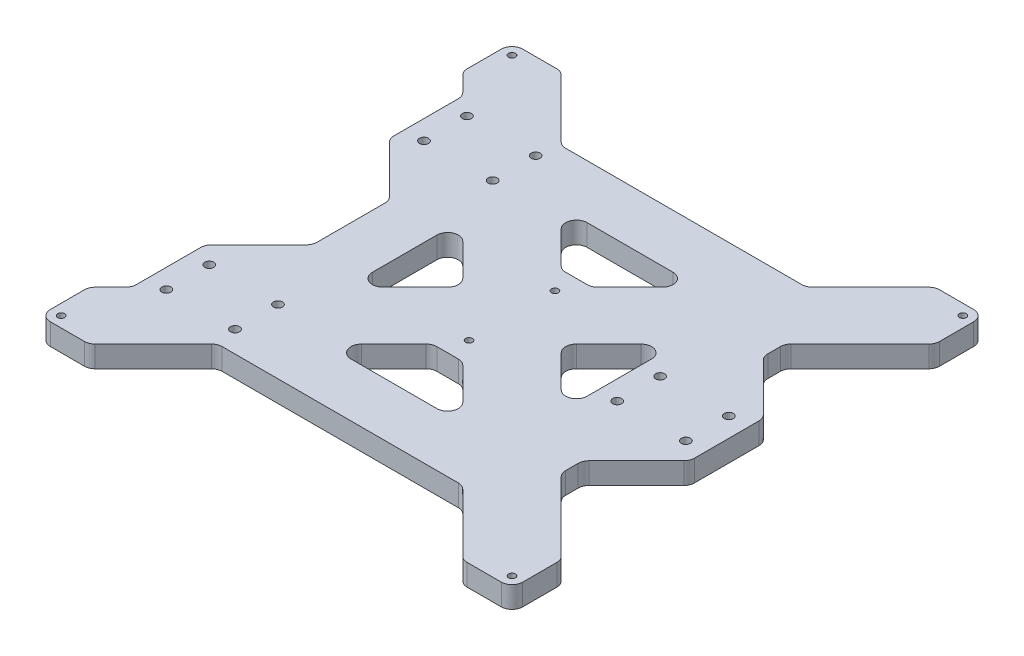
from build123d import *

# Parameters (mm, degrees)
SKETCH_1_R      = 1.6
SKETCH_1_R_2    = 2.1
EXTRUDE_1_DEPTH = 10


with BuildPart() as part:
    # Эскиз1 → Бобышка-Вытянуть1 (new body)
    with BuildSketch(Plane(origin=(0, 0, 0), x_dir=(1, 0, 0), z_dir=(0, 1, 0))):
        with BuildLine():
            Line((-89.142135624, 110), (-105, 110))
            ThreePointArc((-105, 110), (-108.535533906, 108.535533906), (-110, 105))
            Line((-110, 105), (-110, 89.142135624))
            ThreePointArc((-110, 89.142135624), (-109.619397663, 87.228718462), (-108.535533906, 85.606601718))
            Line((-108.535533906, 85.606601718), (-101.464466094, 78.535533906))
            ThreePointArc((-101.464466094, 78.535533906), (-100.380602337, 76.913417162), (-100, 75))
            Line((-100, 75), (-100, 45))
            ThreePointArc((-100, 45), (-99.619397663, 43.086582838), (-98.535533906, 41.464466094))
            Line((-98.535533906, 41.464466094), (-76.464466094, 19.393398282))
            ThreePointArc((-76.464466094, 19.393398282), (-75.380602337, 17.771281538), (-75, 15.857864376))
            Line((-75, 15.857864376), (-75, -15.857864376))
            ThreePointArc((-75, -15.857864376), (-75.380602337, -17.771281538), (-76.464466094, -19.393398282))
            Line((-76.464466094, -19.393398282), (-98.535533906, -41.464466094))
            ThreePointArc((-98.535533906, -41.464466094), (-99.619397663, -43.086582838), (-100, -45))
            Line((-100, -45), (-100, -75))
            ThreePointArc((-100, -75), (-100.380602337, -76.913417162), (-101.464466094, -78.535533906))
            Line((-101.464466094, -78.535533906), (-108.535533906, -85.606601718))
            ThreePointArc((-108.535533906, -85.606601718), (-109.619397663, -87.228718462), (-110, -89.142135624))
            Line((-110, -89.142135624), (-110, -105))
            ThreePointArc((-110, -105), (-108.535533906, -108.535533906), (-105, -110))
            Line((-105, -110), (-89.142135624, -110))
            ThreePointArc((-89.142135624, -110), (-87.228718462, -109.619397663), (-85.606601718, -108.535533906))
            Line((-85.606601718, -108.535533906), (-58.535533906, -81.464466094))
            ThreePointArc((-58.535533906, -81.464466094), (-56.913417162, -80.380602337), (-55, -80))
            Line((-55, -80), (55, -80))
            ThreePointArc((55, -80), (56.913417162, -80.380602337), (58.535533906, -81.464466094))
            Line((58.535533906, -81.464466094), (85.606601718, -108.535533906))
            ThreePointArc((85.606601718, -108.535533906), (87.228718462, -109.619397663), (89.142135624, -110))
            Line((89.142135624, -110), (105, -110))
            ThreePointArc((105, -110), (108.535533906, -108.535533906), (110, -105))
            Line((110, -105), (110, -89.142135624))
            ThreePointArc((110, -89.142135624), (109.619397663, -87.228718462), (108.535533906, -85.606601718))
            Line((108.535533906, -85.606601718), (76.464466094, -53.535533906))
            ThreePointArc((76.464466094, -53.535533906), (75.380602337, -51.913417162), (75, -50))
            Line((75, -50), (75, -44.142135624))
            ThreePointArc((75, -44.142135624), (75.380602337, -42.228718462), (76.464466094, -40.606601718))
            Line((76.464466094, -40.606601718), (98.535533906, -18.535533906))
            ThreePointArc((98.535533906, -18.535533906), (99.619397663, -16.913417162), (100, -15))
            Line((100, -15), (100, 15))
            ThreePointArc((100, 15), (99.619397663, 16.913417162), (98.535533906, 18.535533906))
            Line((98.535533906, 18.535533906), (76.464466094, 40.606601718))
            ThreePointArc((76.464466094, 40.606601718), (75.380602337, 42.228718462), (75, 44.142135624))
            Line((75, 44.142135624), (75, 50))
            ThreePointArc((75, 50), (75.380602337, 51.913417162), (76.464466094, 53.535533906))
            Line((76.464466094, 53.535533906), (108.535533906, 85.606601718))
            ThreePointArc((108.535533906, 85.606601718), (109.619397663, 87.228718462), (110, 89.142135624))
            Line((110, 89.142135624), (110, 105))
            ThreePointArc((110, 105), (108.535533906, 108.535533906), (105, 110))
            Line((105, 110), (89.142135624, 110))
            ThreePointArc((89.142135624, 110), (87.228718462, 109.619397663), (85.606601718, 108.535533906))
            Line((85.606601718, 108.535533906), (58.535533906, 81.464466094))
            ThreePointArc((58.535533906, 81.464466094), (56.913417162, 80.380602337), (55, 80))
            Line((55, 80), (-55, 80))
            ThreePointArc((-55, 80), (-56.913417162, 80.380602337), (-58.535533906, 81.464466094))
            Line((-58.535533906, 81.464466094), (-85.606601718, 108.535533906))
            ThreePointArc((-85.606601718, 108.535533906), (-87.228718462, 109.619397663), (-89.142135624, 110))
        make_face()
        with Locations((-105, -105)):
            Circle(SKETCH_1_R, mode=Mode.SUBTRACT)
        with Locations((-91, -70)):
            Circle(SKETCH_1_R_2, mode=Mode.SUBTRACT)
        with Locations((-59, -70)):
            Circle(SKETCH_1_R_2, mode=Mode.SUBTRACT)
        with Locations((-91, -50)):
            Circle(SKETCH_1_R_2, mode=Mode.SUBTRACT)
        with Locations((-59, -50)):
            Circle(SKETCH_1_R_2, mode=Mode.SUBTRACT)
        with Locations((105, -105)):
            Circle(SKETCH_1_R, mode=Mode.SUBTRACT)
        with BuildLine():
            ThreePointArc((-20, -55), (-24.619397663, -51.913417162), (-23.535533906, -46.464466094))
            Line((-23.535533906, -46.464466094), (-8.535533906, -31.464466094))
            ThreePointArc((-8.535533906, -31.464466094), (-6.913417162, -30.380602337), (-5, -30))
            Line((-5, -30), (5, -30))
            ThreePointArc((5, -30), (6.913417162, -30.380602337), (8.535533906, -31.464466094))
            Line((8.535533906, -31.464466094), (23.535533906, -46.464466094))
            ThreePointArc((23.535533906, -46.464466094), (24.619397663, -51.913417162), (20, -55))
            Line((20, -55), (-20, -55))
        make_face(mode=Mode.SUBTRACT)
        with Locations((0, -20)):
            Circle(SKETCH_1_R, mode=Mode.SUBTRACT)
        with Locations((59, -10)):
            Circle(SKETCH_1_R_2, mode=Mode.SUBTRACT)
        with Locations((91, -10)):
            Circle(SKETCH_1_R_2, mode=Mode.SUBTRACT)
        with Locations((-91, 50)):
            Circle(SKETCH_1_R_2, mode=Mode.SUBTRACT)
        with Locations((-59, 50)):
            Circle(SKETCH_1_R_2, mode=Mode.SUBTRACT)
        with BuildLine():
            Line((-50, -15), (-50, 15))
            ThreePointArc((-50, 15), (-46.913417162, 19.619397663), (-41.464466094, 18.535533906))
            Line((-41.464466094, 18.535533906), (-26.464466094, 3.535533906))
            ThreePointArc((-26.464466094, 3.535533906), (-25, 0), (-26.464466094, -3.535533906))
            Line((-26.464466094, -3.535533906), (-41.464466094, -18.535533906))
            ThreePointArc((-41.464466094, -18.535533906), (-46.913417162, -19.619397663), (-50, -15))
        make_face(mode=Mode.SUBTRACT)
        with Locations((-91, 70)):
            Circle(SKETCH_1_R_2, mode=Mode.SUBTRACT)
        with Locations((-59, 70)):
            Circle(SKETCH_1_R_2, mode=Mode.SUBTRACT)
        with Locations((-105, 105)):
            Circle(SKETCH_1_R, mode=Mode.SUBTRACT)
        with Locations((0, 20)):
            Circle(SKETCH_1_R, mode=Mode.SUBTRACT)
        with BuildLine():
            Line((26.464466094, 3.535533906), (41.464466094, 18.535533906))
            ThreePointArc((41.464466094, 18.535533906), (46.913417162, 19.619397663), (50, 15))
            Line((50, 15), (50, -15))
            ThreePointArc((50, -15), (46.913417162, -19.619397663), (41.464466094, -18.535533906))
            Line((41.464466094, -18.535533906), (26.464466094, -3.535533906))
            ThreePointArc((26.464466094, -3.535533906), (25, 0), (26.464466094, 3.535533906))
        make_face(mode=Mode.SUBTRACT)
        with BuildLine():
            ThreePointArc((20, 55), (24.619397663, 51.913417162), (23.535533906, 46.464466094))
            Line((23.535533906, 46.464466094), (8.535533906, 31.464466094))
            ThreePointArc((8.535533906, 31.464466094), (6.913417162, 30.380602337), (5, 30))
            Line((5, 30), (-5, 30))
            ThreePointArc((-5, 30), (-6.913417162, 30.380602337), (-8.535533906, 31.464466094))
            Line((-8.535533906, 31.464466094), (-23.535533906, 46.464466094))
            ThreePointArc((-23.535533906, 46.464466094), (-24.619397663, 51.913417162), (-20, 55))
            Line((-20, 55), (20, 55))
        make_face(mode=Mode.SUBTRACT)
        with Locations((59, 10)):
            Circle(SKETCH_1_R_2, mode=Mode.SUBTRACT)
        with Locations((91, 10)):
            Circle(SKETCH_1_R_2, mode=Mode.SUBTRACT)
        with Locations((105, 105)):
            Circle(SKETCH_1_R, mode=Mode.SUBTRACT)
    extrude(amount=EXTRUDE_1_DEPTH)


solid = part.part
